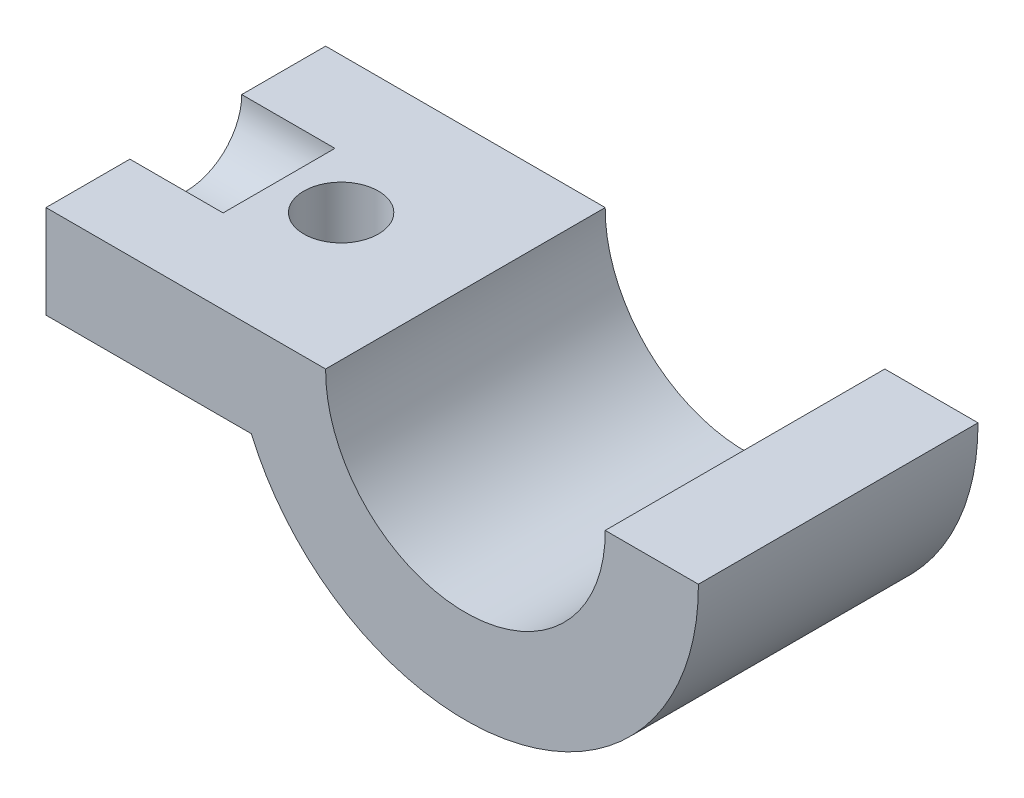
from build123d import *

# Parameters (mm, degrees)
EXTRUDE_START       = -1.5
EXTRUDE_1_OUTLINE_R = 0.75
EXTRUDE_1_DEPTH     = 1.5
SKETCH_3_R          = 0.3
CUT_EXTRUDE_1_DEPTH = 0.5
SKETCH_4_R          = 0.2
CUT_EXTRUDE_2_DEPTH = 0.5
SKETCH_5_W          = 3.047212849
SKETCH_5_H          = 1.728243789
CUT_EXTRUDE_3_DEPTH = 3.12


# Read off the part's stored shape, not the designer's step: 凸台-拉伸1
with BuildPart() as part:
    # 凸台-拉伸1 outline → 凸台-拉伸1 (new body)
    with BuildSketch(Plane.XY.offset(EXTRUDE_START)):
        with BuildLine():
            Line((7.75, 0), (7.75, -0.5))
            Line((7.75, -0.5), (8.851510108, -0.5))
            ThreePointArc((8.851510108, -0.5), (11.224999287, 0.242146363), (8.750004894, 0))
            Line((8.750004894, 0), (7.75, 0))
        make_face()
        with Locations((9.999987765, -0.006543751)):
            Circle(EXTRUDE_1_OUTLINE_R, mode=Mode.SUBTRACT)
    extrude(amount=EXTRUDE_1_DEPTH)

    # 草图3 → 切除-拉伸1 (cut)
    with BuildSketch(Plane.ZY.offset(-7.75)):
        with Locations((-0.75, 0)):
            Circle(SKETCH_3_R)
    extrude(amount=-CUT_EXTRUDE_1_DEPTH, mode=Mode.SUBTRACT)

    # 草图4 → 切除-拉伸2 (cut)
    with BuildSketch(Plane(origin=(0, 0, 0), x_dir=(1, 0, 0), z_dir=(0, 1, 0))):
        with Locations(Location((8.564809318, 0.768458185, 0), (0, 0, 180))):
            Circle(SKETCH_4_R)
    extrude(amount=-CUT_EXTRUDE_2_DEPTH, mode=Mode.SUBTRACT)

    # 草图5 → 切除-拉伸3 (cut)
    with BuildSketch(Plane(origin=(0, 0, -1.5), x_dir=(-1, 0, 0), z_dir=(0, 0, -1))):
        with Locations((-10.273611319, 0.864121895)):
            Rectangle(SKETCH_5_W, SKETCH_5_H)
    extrude(amount=-CUT_EXTRUDE_3_DEPTH, mode=Mode.SUBTRACT)


solid = part.part
